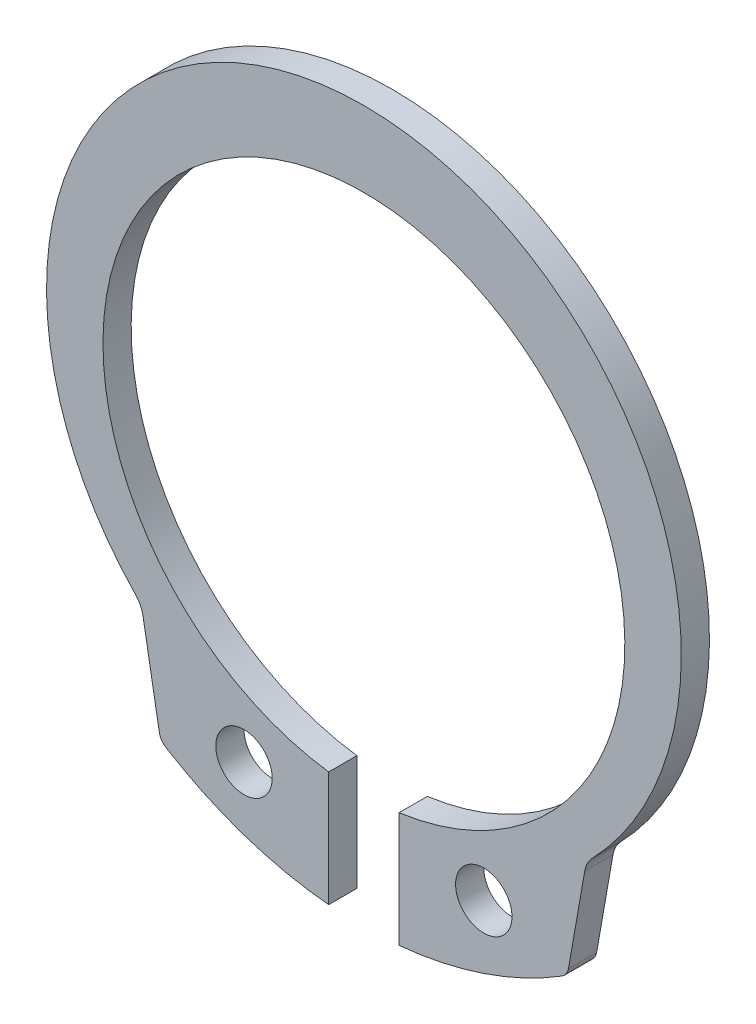
from build123d import *

# Parameters (mm, degrees)
EXTRUDE_849_DEPTH      = 0.5
EXTRUDE_849_DEPTH_BACK = 0.5
SKETCH_1_R             = 1


with BuildPart() as part:
    # 草图1 → Extrude 849 (new, two sides: drawn at the far end of the back side and taken through both)
    with BuildSketch(Plane.XY.offset(-EXTRUDE_849_DEPTH_BACK)):
        with BuildLine():
            Line((-1.25, -9.83515139), (-1.25, -13.911129106))
            ThreePointArc((-1.25, -13.911129106), (-4.248657866, -13.273130815), (-7.021564722, -11.965469395))
            ThreePointArc((-7.021564722, -11.965469395), (-7.171788127, -11.820908006), (-7.25, -11.627651777))
            Line((-7.25, -11.627651777), (-7.831163033, -8.331712432))
            ThreePointArc((-7.831163033, -8.331712432), (-7.924856006, -8.051582636), (-8.096299702, -7.811045457))
            ThreePointArc((-8.096299702, -7.811045457), (0, 11.25), (8.096299702, -7.811045457))
            ThreePointArc((8.096299702, -7.811045457), (7.924856006, -8.051582636), (7.831163033, -8.331712432))
            Line((7.831163033, -8.331712432), (7.25, -11.627651777))
            ThreePointArc((7.25, -11.627651777), (7.171788127, -11.820908006), (7.021564722, -11.965469395))
            ThreePointArc((7.021564722, -11.965469395), (4.248657866, -13.273130815), (1.25, -13.911129106))
            Line((1.25, -13.911129106), (1.25, -9.83515139))
            ThreePointArc((1.25, -9.83515139), (0, 8.58), (-1.25, -9.83515139))
        make_face()
        with Locations((-4.25, -11.032311518)):
            Circle(SKETCH_1_R, mode=Mode.SUBTRACT)
        with Locations((4.25, -11.032311518)):
            Circle(SKETCH_1_R, mode=Mode.SUBTRACT)
    extrude(amount=EXTRUDE_849_DEPTH + EXTRUDE_849_DEPTH_BACK)


solid = part.part
